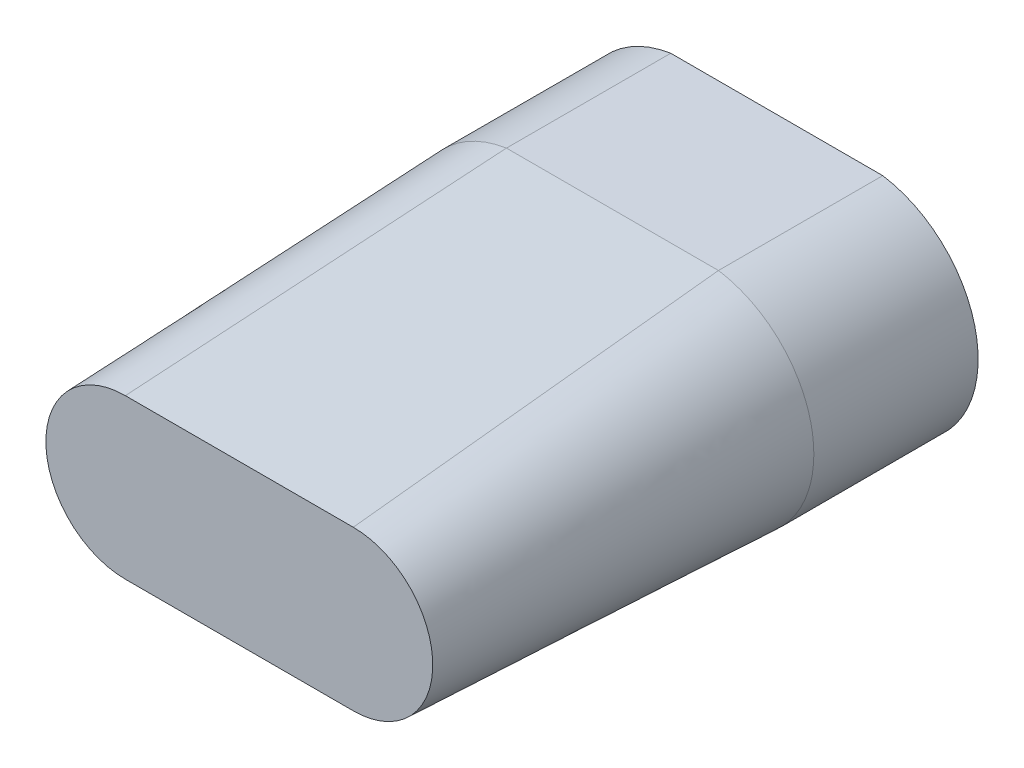
from build123d import *

# Parameters (mm, degrees)
EXTRUDE_1_DEPTH = 15.5
SKETCH_3_W      = 5.5
SKETCH_3_H      = 2


with BuildPart() as part:
    # ｽｹｯﾁ1 → ﾎﾞｽ - 押し出し1 (new body)
    with BuildSketch(Plane.XY):
        with BuildLine():
            Line((-9.95247038, -10.433367245), (10.04752962, -10.433367245))
            ThreePointArc((10.04752962, -10.433367245), (19.04752962, 0.066632755), (10.04752962, 10.566632755))
            Line((10.04752962, 10.566632755), (-9.95247038, 10.566632755))
            ThreePointArc((-9.95247038, 10.566632755), (-18.95247038, 0.066632755), (-9.95247038, -10.433367245))
        make_face()
    extrude(amount=EXTRUDE_1_DEPTH)

    # ﾛﾌﾄ1: read off the stored shape, not the designer's step
    # ﾛﾌﾄ1: loft between two sections, ruled curve by curve
    loft_1_from = [
        Edge.make_bspline([(-10.70247038, -7.433367245, 50.7), (-11.32747038, -7.433367245, 50.7), (-12.03447038, -7.357367245, 50.7), (-13.18647038, -7.021367245, 50.7), (-13.584997838, -6.871885109, 50.7), (-14.392976629, -6.477995449, 50.7), (-14.80247038, -6.233367245, 50.7), (-15.60247038, -5.633367245, 50.7), (-15.992862573, -5.277709523, 50.7), (-16.713448049, -4.452038666, 50.7), (-17.04330083, -3.981810152, 50.7), (-17.596934048, -2.943747868, 50.7), (-17.820221859, -2.375970796, 50.7), (-18.123180439, -1.183071387, 50.7), (-18.20247038, -0.558367245, 50.7), (-18.20247038, 0.691632755, 50.7), (-18.123180439, 1.316336897, 50.7), (-17.820221859, 2.509236305, 50.7), (-17.596934048, 3.077013378, 50.7), (-17.04330083, 4.115075661, 50.7), (-16.713448049, 4.585304175, 50.7), (-15.992862573, 5.410975033, 50.7), (-15.60247038, 5.766632755, 50.7), (-14.80247038, 6.366632755, 50.7), (-14.392976629, 6.611260958, 50.7), (-13.584997838, 7.005150619, 50.7), (-13.18647038, 7.154632755, 50.7), (-12.03447038, 7.490632755, 50.7), (-11.32747038, 7.566632755, 50.7), (-10.70247038, 7.566632755, 50.7)], [0, 0, 0, 0, 0.125, 0.125, 0.1875, 0.1875, 0.25, 0.25, 0.3125, 0.3125, 0.375, 0.375, 0.4375, 0.4375, 0.5, 0.5, 0.5625, 0.5625, 0.625, 0.625, 0.6875, 0.6875, 0.75, 0.75, 0.8125, 0.8125, 0.875, 0.875, 1, 1, 1, 1], 3),
        Edge.make_bspline([(10.79752962, 7.566632755, 50.7), (11.42252962, 7.566632755, 50.7), (12.12952962, 7.490632755, 50.7), (13.28152962, 7.154632755, 50.7), (13.680057079, 7.005150619, 50.7), (14.488035869, 6.611260958, 50.7), (14.89752962, 6.366632755, 50.7), (15.69752962, 5.766632755, 50.7), (16.087921814, 5.410975033, 50.7), (16.80850729, 4.585304175, 50.7), (17.13836007, 4.115075661, 50.7), (17.691993288, 3.077013378, 50.7), (17.9152811, 2.509236305, 50.7), (18.218239679, 1.316336897, 50.7), (18.29752962, 0.691632755, 50.7), (18.29752962, -0.558367245, 50.7), (18.218239679, -1.183071387, 50.7), (17.9152811, -2.375970796, 50.7), (17.691993288, -2.943747868, 50.7), (17.13836007, -3.981810152, 50.7), (16.80850729, -4.452038666, 50.7), (16.087921814, -5.277709523, 50.7), (15.69752962, -5.633367245, 50.7), (14.89752962, -6.233367245, 50.7), (14.488035869, -6.477995449, 50.7), (13.680057079, -6.871885109, 50.7), (13.28152962, -7.021367245, 50.7), (12.12952962, -7.357367245, 50.7), (11.42252962, -7.433367245, 50.7), (10.79752962, -7.433367245, 50.7)], [0, 0, 0, 0, 0.125, 0.125, 0.1875, 0.1875, 0.25, 0.25, 0.3125, 0.3125, 0.375, 0.375, 0.4375, 0.4375, 0.5, 0.5, 0.5625, 0.5625, 0.625, 0.625, 0.6875, 0.6875, 0.75, 0.75, 0.8125, 0.8125, 0.875, 0.875, 1, 1, 1, 1], 3),
        Edge.make_line((10.79752962, 7.566632755, 50.7), (-10.70247038, 7.566632755, 50.7)),
        Edge.make_line((-10.70247038, -7.433367245, 50.7), (10.79752962, -7.433367245, 50.7)),
    ]
    loft_1_to = [
        Edge.make_bspline([(-9.95247038, -10.433367245, 15.5), (-10.817176262, -10.299543716, 15.5), (-11.761496302, -10.045319701, 15.5), (-13.227109043, -9.37648849, 15.5), (-13.722944193, -9.105456696, 15.5), (-14.704791413, -8.452060748, 15.5), (-15.190765564, -8.069514689, 15.5), (-16.119347609, -7.185150836, 15.5), (-16.561797454, -6.683155076, 15.5), (-17.36337452, -5.565082304, 15.5), (-17.722220528, -4.948923462, 15.5), (-18.316866572, -3.625128102, 15.5), (-18.552340539, -2.917597164, 15.5), (-18.870254697, -1.451028878, 15.5), (-18.95247038, -0.692295817, 15.5), (-18.95247038, 0.825561326, 15.5), (-18.870254697, 1.584294387, 15.5), (-18.552340539, 3.050862673, 15.5), (-18.316866572, 3.758393611, 15.5), (-17.722220528, 5.082188971, 15.5), (-17.36337452, 5.698347814, 15.5), (-16.561797454, 6.816420586, 15.5), (-16.119347609, 7.318416346, 15.5), (-15.190765564, 8.202780198, 15.5), (-14.704791413, 8.585326258, 15.5), (-13.722944193, 9.238722205, 15.5), (-13.227109043, 9.509754, 15.5), (-11.761496302, 10.178585211, 15.5), (-10.817176262, 10.432809225, 15.5), (-9.95247038, 10.566632755, 15.5)], [0, 0, 0, 0, 0.125, 0.125, 0.1875, 0.1875, 0.25, 0.25, 0.3125, 0.3125, 0.375, 0.375, 0.4375, 0.4375, 0.5, 0.5, 0.5625, 0.5625, 0.625, 0.625, 0.6875, 0.6875, 0.75, 0.75, 0.8125, 0.8125, 0.875, 0.875, 1, 1, 1, 1], 3),
        Edge.make_bspline([(10.04752962, 10.566632755, 15.5), (10.912235503, 10.432809225, 15.5), (11.856555543, 10.178585211, 15.5), (13.322168284, 9.509754, 15.5), (13.818003433, 9.238722205, 15.5), (14.799850654, 8.585326258, 15.5), (15.285824805, 8.202780198, 15.5), (16.21440685, 7.318416346, 15.5), (16.656856694, 6.816420586, 15.5), (17.45843376, 5.698347814, 15.5), (17.817279769, 5.082188971, 15.5), (18.411925813, 3.758393611, 15.5), (18.64739978, 3.050862673, 15.5), (18.965313937, 1.584294387, 15.5), (19.04752962, 0.825561326, 15.5), (19.04752962, -0.692295817, 15.5), (18.965313937, -1.451028878, 15.5), (18.64739978, -2.917597164, 15.5), (18.411925813, -3.625128102, 15.5), (17.817279769, -4.948923462, 15.5), (17.45843376, -5.565082304, 15.5), (16.656856694, -6.683155076, 15.5), (16.21440685, -7.185150836, 15.5), (15.285824805, -8.069514689, 15.5), (14.799850654, -8.452060748, 15.5), (13.818003433, -9.105456696, 15.5), (13.322168284, -9.37648849, 15.5), (11.856555543, -10.045319701, 15.5), (10.912235503, -10.299543716, 15.5), (10.04752962, -10.433367245, 15.5)], [0, 0, 0, 0, 0.125, 0.125, 0.1875, 0.1875, 0.25, 0.25, 0.3125, 0.3125, 0.375, 0.375, 0.4375, 0.4375, 0.5, 0.5, 0.5625, 0.5625, 0.625, 0.625, 0.6875, 0.6875, 0.75, 0.75, 0.8125, 0.8125, 0.875, 0.875, 1, 1, 1, 1], 3),
        Edge.make_line((10.04752962, 10.566632755, 15.5), (-9.95247038, 10.566632755, 15.5)),
        Edge.make_line((-9.95247038, -10.433367245, 15.5), (10.04752962, -10.433367245, 15.5)),
    ]
    loft_1 = Solid(Shell([*[Face.make_surface_from_curves(loft_1_from[k], loft_1_to[k]) for k in range(4)], Face(Wire(loft_1_from)), Face(Wire(loft_1_to))]))
    add(loft_1)

    # ｽｹｯﾁ3 → 回転1 (revolve)
    with BuildSketch(Plane(origin=(0, -3, 0), x_dir=(1, 0, 0), z_dir=(0, 1, 0))):
        with Locations((0, -31.2)):
            Rectangle(SKETCH_3_W, SKETCH_3_H)
    revolve(axis=Axis((5.729281216, -3, 37.7), (-1, 0, 0)))


solid = part.part
